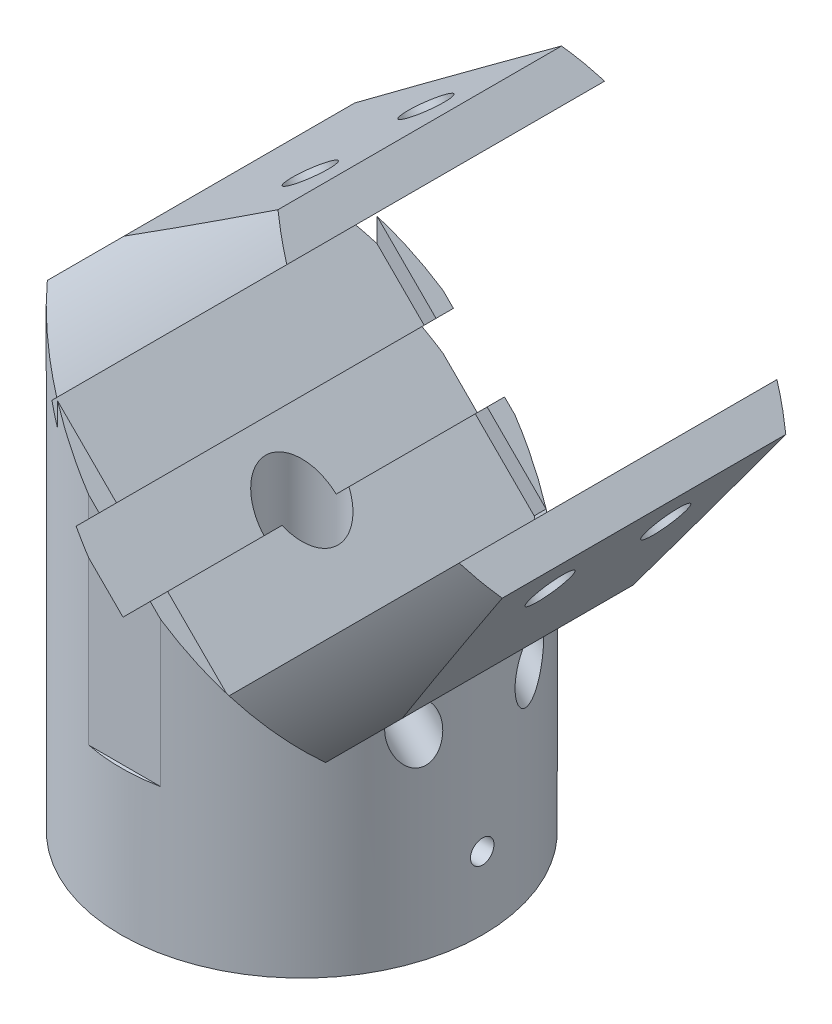
from build123d import *

# Parameters (mm, degrees)
SKETCH1_R               = 25
SKETCH1_R_2             = 20.15
BOSS_EXTRUDE1_DEPTH     = 10
SKETCH2_R               = 25
BOSS_EXTRUDE2_DEPTH     = 5
BOSS_EXTRUDE3_DEPTH     = 50
CUT_EXTRUDE1_DEPTH      = 50
SKETCH5_W               = 44
SKETCH5_H               = 33.5
CUT_EXTRUDE2_DEPTH      = 2.33
SKETCH6_W               = 31.902194282
SKETCH6_H               = 10.372222151
BOSS_EXTRUDE5_DEPTH     = 45
BOSS_EXTRUDE6_DEPTH     = 45
BOSS_EXTRUDE7_DEPTH     = 20
SKETCH10_R              = 1.375
CUT_EXTRUDE3_DEPTH      = 77
SKETCH11_R              = 1.375
CUT_EXTRUDE4_DEPTH      = 77
SKETCH12_R              = 3
CUT_EXTRUDE5_DEPTH      = 7.38
CUT_EXTRUDE6_DEPTH      = 7.88
CUT_EXTRUDE6_DEPTH_BACK = 7.38
SKETCH13_R              = 3
CHAMFER1_SIZE           = 30
CHAMFER1_SIZE_2         = 5.289809421
CUT_EXTRUDE7_DEPTH      = 37
CUT_EXTRUDE7_DEPTH_BACK = 37
SKETCH16_R              = 1.625
SKETCH17_R              = 21.025
CUT_EXTRUDE8_DEPTH      = 10
BOSS_EXTRUDE8_START     = 5
SKETCH18_R              = 25
SKETCH18_R_2            = 21.025
BOSS_EXTRUDE8_DEPTH     = 5
SKETCH19_R              = 5
CUT_EXTRUDE9_DEPTH      = 40
SKETCH20_W              = 5.989584726
SKETCH20_H              = 10
SKETCH20_W_2            = 7.89908722
CUT_EXTRUDE10_DEPTH     = 40
SKETCH20_6_W            = 5.989584726
SKETCH20_6_H            = 10
SKETCH20_6_W_2          = 7.89908722
CUT_EXTRUDE14_DEPTH     = 3
FILLET1_R               = 2


with BuildPart() as part:
    # Sketch1 → Boss-Extrude1 (new body)
    with BuildSketch(Plane(origin=(0, 0, 0), x_dir=(1, 0, 0), z_dir=(0, 1, 0))):
        with Locations(Location((0, 0, 0), (0, 0, 270))):
            Circle(SKETCH1_R)
        with Locations(Location((0, 0, 0), (0, 0, 270))):
            Circle(SKETCH1_R_2, mode=Mode.SUBTRACT)
    extrude(amount=BOSS_EXTRUDE1_DEPTH)

    # Sketch2 → Boss-Extrude2 (add)
    with BuildSketch(Plane(origin=(0, 10, 0), x_dir=(1, 0, 0), z_dir=(0, 1, 0))):
        with Locations(Location((0, 0, 0), (0, 0, 270))):
            Circle(SKETCH2_R)
    extrude(amount=BOSS_EXTRUDE2_DEPTH)

    # Sketch3 → Boss-Extrude3 (add)
    with BuildSketch(Plane(origin=(0, 15, 0), x_dir=(1, 0, 0), z_dir=(0, 1, 0))):
        with BuildLine():
            ThreePointArc((4.974937186, -24.5), (12.844564237, -21.448010853), (19.25, -15.951097141))
            Line((19.25, -15.951097141), (19.25, 15.951097141))
            ThreePointArc((19.25, 15.951097141), (12.844564237, 21.448010853), (4.974937186, 24.5))
            Line((4.974937186, 24.5), (-4.974937186, 24.5))
            ThreePointArc((-4.974937186, 24.5), (-12.844564237, 21.448010853), (-19.25, 15.951097141))
            Line((-19.25, 15.951097141), (-19.25, -15.951097141))
            ThreePointArc((-19.25, -15.951097141), (-12.844564237, -21.448010853), (-4.974937186, -24.5))
            Line((-4.974937186, -24.5), (4.974937186, -24.5))
        make_face()
    extrude(amount=BOSS_EXTRUDE3_DEPTH)

    # Sketch4 → Cut-Extrude1 (cut)
    with BuildSketch(Plane.XY.offset(24.5)):
        Polygon((-4.974937186, 44.974937186), (4.974937186, 35.025062814), (4.974937186, 65), (-4.974937186, 65), align=None)
        Polygon((4.974937186, 35.025062814), (25, 15), (25, 65), (4.974937186, 65), align=None)
        Polygon((-19.25, 59.25), (-4.974937186, 44.974937186), (-4.974937186, 65), (-19.25, 65), align=None)
    extrude(amount=-CUT_EXTRUDE1_DEPTH, mode=Mode.SUBTRACT)

    # Sketch5 → Cut-Extrude2 (cut)
    # profile 1 of 2: a face of its own
    with BuildSketch(Plane(origin=(20, 20, 0), x_dir=(0, 0, -1), z_dir=(0.7071067811865485, 0.7071067811865467, 0))):
        with BuildLine():
            Line((21.978674947, 45.132882323), (-21.978674947, 45.132882323))
            add(Edge.make_bspline(
                [(-21.978674947, 45.132882323), (-22.0399199, 44.9730967), (-22.1, 44.81242904)],
                knots=[4.215256564, 4.215256564, 4.215256564, 4.225444941, 4.225444941, 4.225444941], degree=2, weights=[0.971948047, 0.972055152, 0.97218796]))
            Line((-22.1, 44.81242904), (-22.1, 11.756113455))
            add(Edge.make_bspline(
                [(-22.1, 11.756113455), (-22.039397631, 11.594049133), (-21.977610099, 11.432882323)],
                knots=[5.19933302, 5.19933302, 5.19933302, 5.20960995, 5.20960995, 5.20960995], degree=2, weights=[0.97218796, 0.972053998, 0.971946187]))
            Line((-21.977610099, 11.432882323), (21.977610099, 11.432882323))
            add(Edge.make_bspline(
                [(21.977610099, 11.432882323), (22.039397631, 11.594049133), (22.1, 11.756113455)],
                knots=[1.073575357, 1.073575357, 1.073575357, 1.083852287, 1.083852287, 1.083852287], degree=2, weights=[0.971946187, 0.972053998, 0.97218796]))
            Line((22.1, 11.756113455), (22.1, 44.81242904))
            add(Edge.make_bspline(
                [(22.1, 44.81242904), (22.0399199, 44.9730967), (21.978674947, 45.132882323)],
                knots=[2.057740366, 2.057740366, 2.057740366, 2.067928743, 2.067928743, 2.067928743], degree=2, weights=[0.97218796, 0.972055152, 0.971948047]))
        make_face()
        with Locations((0, 28.282882323)):
            Rectangle(SKETCH5_W, SKETCH5_H, mode=Mode.SUBTRACT)
    # profile 2 of 2: a face of its own
    with BuildSketch(Plane(origin=(20, 20, 0), x_dir=(0, 0, -1), z_dir=(0.7071067811865485, 0.7071067811865467, 0))):
        with Locations((0, 28.282882323)):
            Rectangle(SKETCH5_W, SKETCH5_H)
    extrude(amount=-CUT_EXTRUDE2_DEPTH, mode=Mode.SUBTRACT)

    # Sketch6 → Boss-Extrude5 (add)
    with BuildSketch(Plane(origin=(20, 20, 0), x_dir=(0, 0, -1), z_dir=(0.7071067811865487, 0.7071067811865465, 0))):
        with BuildLine():
            Line((-15.951097141, 1.060660172), (-15.951097141, 11.432882323))
            Line((-15.951097141, 11.432882323), (-21.977610099, 11.432882323))
            add(Edge.make_bspline(
                [(-21.977610099, 11.432882323), (-19.67346685, 5.422747233), (-15.951097141, 1.060660172)],
                knots=[5.209205396, 5.209205396, 5.209205396, 5.591230132, 5.591230132, 5.591230132], degree=2, weights=[1, 0.981812537, 1]))
        make_face()
        with Locations((0, 6.246771248)):
            Rectangle(SKETCH6_W, SKETCH6_H)
        with BuildLine():
            Line((21.977610099, 11.432882323), (15.951097141, 11.432882323))
            Line((15.951097141, 11.432882323), (15.951097141, 1.060660172))
            add(Edge.make_bspline(
                [(15.951097141, 1.060660172), (19.67346685, 5.422747233), (21.977610099, 11.432882323)],
                knots=[0.691955175, 0.691955175, 0.691955175, 1.073979912, 1.073979912, 1.073979912], degree=2, weights=[1, 0.981812537, 1]))
        make_face()
    extrude(amount=BOSS_EXTRUDE5_DEPTH)

    # Sketch7 → Boss-Extrude6 (add)
    with BuildSketch(Plane(origin=(20, 20, 0), x_dir=(0, 0, -1), z_dir=(0.7071067811865487, 0.7071067811865465, 0))):
        with BuildLine():
            Line((15.951097141, 55.507882323), (-15.951097141, 55.507882323))
            add(Edge.make_bspline(
                [(-15.951097141, 55.507882323), (-19.67435923, 51.144749519), (-21.978674947, 45.132882323)],
                knots=[3.833547829, 3.833547829, 3.833547829, 4.215661937, 4.215661937, 4.215661937], degree=2, weights=[1, 0.981804052, 1]))
            Line((-21.978674947, 45.132882323), (21.978674947, 45.132882323))
            add(Edge.make_bspline(
                [(21.978674947, 45.132882323), (19.67435923, 51.144749519), (15.951097141, 55.507882323)],
                knots=[2.06752337, 2.06752337, 2.06752337, 2.449637478, 2.449637478, 2.449637478], degree=2, weights=[1, 0.981804052, 1]))
        make_face()
    extrude(amount=BOSS_EXTRUDE6_DEPTH)

    # Sketch8 → Boss-Extrude7 (add)
    with BuildSketch(Plane(origin=(0, 15, 0), x_dir=(1, 0, 0), z_dir=(0, 1, 0))):
        with BuildLine():
            ThreePointArc((25, 0), (23.518609653, 8.477912479), (19.25, 15.951097141))
            Line((19.25, 15.951097141), (19.25, -15.951097141))
            ThreePointArc((19.25, -15.951097141), (23.518609653, -8.477912479), (25, 0))
        make_face()
    extrude(amount=BOSS_EXTRUDE7_DEPTH)

    # Sketch10 → Cut-Extrude3 (cut)
    with BuildSketch(Plane(origin=(-39.25, 39.25, 0), x_dir=(0, 0, 1), z_dir=(-0.7071067811865464, 0.7071067811865487, 0))):
        with Locations(Location((8.001097141, 32.704271247, 0), (0, 0, 270))):
            Circle(SKETCH10_R)
        with Locations(Location((-7.998902859, 32.704271247, 0), (0, 0, 270))):
            Circle(SKETCH10_R)
    extrude(amount=-CUT_EXTRUDE3_DEPTH, mode=Mode.SUBTRACT)

    # Sketch11 → Cut-Extrude4 (cut)
    with BuildSketch(Plane(origin=(-39.25, 39.25, 0), x_dir=(0, 0, 1), z_dir=(-0.7071067811865464, 0.7071067811865487, 0))):
        with Locations(Location((-7.998902859, 64.704271247, 0), (0, 0, 270))):
            Circle(SKETCH11_R)
        with Locations(Location((8.001097141, 64.704271247, 0), (0, 0, 270))):
            Circle(SKETCH11_R)
    extrude(amount=-CUT_EXTRUDE4_DEPTH, mode=Mode.SUBTRACT)

    # Sketch12 → Cut-Extrude5 (cut)
    with BuildSketch(Plane(origin=(-39.25, 39.25, 0), x_dir=(0, 0, 1), z_dir=(-0.7071067811865464, 0.7071067811865487, 0))):
        with Locations(Location((-7.998902859, 64.704271247, 0), (0, 0, 270))):
            Circle(SKETCH12_R)
        with Locations(Location((8.001097141, 64.704271247, 0), (0, 0, 270))):
            Circle(SKETCH12_R)
        with Locations(Location((-7.998902859, 32.704271247, 0), (0, 0, 270))):
            Circle(SKETCH12_R)
        with Locations(Location((8.001097141, 32.704271247, 0), (0, 0, 270))):
            Circle(SKETCH12_R)
    extrude(amount=-CUT_EXTRUDE5_DEPTH, mode=Mode.SUBTRACT)

    # Sketch13 → Cut-Extrude6 (cut, two sides: drawn at the far end of the back side and taken through both)
    with BuildSketch(Plane(origin=(-0.75, 0.75, 0), x_dir=(0, 0, -1), z_dir=(0.7071067811865464, -0.7071067811865487, 0)).offset(-CUT_EXTRUDE6_DEPTH_BACK)):
        with Locations(Location((-8.001097141, 64.704271247, 0), (0, 0, 270))):
            Circle(SKETCH13_R)
        with Locations(Location((7.998902859, 64.704271247, 0), (0, 0, 270))):
            Circle(SKETCH13_R)
        with Locations(Location((-8.001097141, 32.704271247, 0), (0, 0, 270))):
            Circle(SKETCH13_R)
        with Locations(Location((7.998902859, 32.704271247, 0), (0, 0, 270))):
            Circle(SKETCH13_R)
    extrude(amount=CUT_EXTRUDE6_DEPTH + CUT_EXTRUDE6_DEPTH_BACK, mode=Mode.SUBTRACT)

    # Chamfer1
    # the kernel refuses this chamfer: 30, 5.289809421 mm, written as the material it takes off along each edge
    with BuildSketch(Plane(origin=(51.069805153, 52.569805153, 93.907261034), x_dir=(-0.7023657291994666, -0.7118162560985113, 0), z_dir=(0, 0, -1)), Plane(origin=(12.569805153, 91.069805153, -93.907261034), x_dir=(-0.7118162560985133, -0.7023657291994647, 0), z_dir=(0, 0, 1))) as chamfer1_piece_1:
        Polygon((CHAMFER1_SIZE * 0.999977671636, CHAMFER1_SIZE * 0.0066825316561), (-CHAMFER1_SIZE_2 * 0.00668253165642, CHAMFER1_SIZE_2 * 0.999977671684), (0, 0), align=None)
    extrude(amount=187.814522067, mode=Mode.SUBTRACT)

    # Sketch16 → Cut-Extrude7 (cut, two sides: drawn at the far end of the back side and taken through both)
    with BuildSketch(Plane(origin=(0, 0, 0), x_dir=(0, 0, -1), z_dir=(1, 0, 0)).offset(-CUT_EXTRUDE7_DEPTH_BACK)):
        with Locations(Location((0, 5, 0), (0, 0, 180))):
            Circle(SKETCH16_R)
    extrude(amount=CUT_EXTRUDE7_DEPTH + CUT_EXTRUDE7_DEPTH_BACK, mode=Mode.SUBTRACT)

    # Sketch17 → Cut-Extrude8 (cut)
    with BuildSketch(Plane.XZ):
        with Locations(Location((0, 0, 0), (0, 0, 270))):
            Circle(SKETCH17_R)
    extrude(amount=-CUT_EXTRUDE8_DEPTH, mode=Mode.SUBTRACT)

    # Sketch18 → Boss-Extrude8 (add)
    with BuildSketch(Plane.XZ.offset(BOSS_EXTRUDE8_START)):
        with Locations(Location((0, 0, 0), (0, 0, 270))):
            Circle(SKETCH18_R)
        with Locations(Location((0, 0, 0), (0, 0, 270))):
            Circle(SKETCH18_R_2, mode=Mode.SUBTRACT)
    extrude(amount=-BOSS_EXTRUDE8_DEPTH)

    # Sketch19 → Cut-Extrude9 (cut)
    with BuildSketch(Plane.XZ.offset(-10)):
        with Locations(Location((0, 0, 0), (0, 0, 270))):
            Circle(SKETCH19_R)
    extrude(amount=-CUT_EXTRUDE9_DEPTH, mode=Mode.SUBTRACT)

    # Sketch20 → Cut-Extrude10 (cut)
    with BuildSketch(Plane(origin=(18.3524412, 18.3524412, 0), x_dir=(0, 0, -1), z_dir=(0.7071067811865482, 0.7071067811865468, 0))):
        with Locations((-25.094792363, 28.282882323)):
            Rectangle(SKETCH20_W, SKETCH20_H)
        with Locations((26.04954361, 28.282882323)):
            Rectangle(SKETCH20_W_2, SKETCH20_H)
    extrude(amount=CUT_EXTRUDE10_DEPTH, mode=Mode.SUBTRACT)

    # Sketch20<6> → Cut-Extrude14 (cut)
    with BuildSketch(Plane(origin=(18.3524412, 18.3524412, 0), x_dir=(0, 0, -1), z_dir=(0.7071067811865482, 0.7071067811865468, 0))):
        with BuildLine():
            Line((22.1, 33.282882323), (-22.1, 33.282882323))
            Line((-22.1, 33.282882323), (-22.1, 23.282882323))
            Line((-22.1, 23.282882323), (-4.629453597, 23.282882323))
            add(Edge.make_bspline(
                [(4.629453597, 23.282882323), (7.440356706, 33.025339059), (0, 33.025339059), (-7.440356706, 33.025339059), (-4.629453597, 23.282882323)],
                knots=[1.183386525, 1.183386525, 1.183386525, 3.141592654, 3.141592654, 5.099798782, 5.099798782, 5.099798782], degree=2, weights=[1, 0.557767225, 1, 0.557767225, 1]))
            Line((4.629453597, 23.282882323), (22.1, 23.282882323))
            Line((22.1, 23.282882323), (22.1, 33.282882323))
        make_face()
        with BuildLine():
            add(Edge.make_bspline(
                [(4.629453597, 23.282882323), (7.440356706, 33.025339059), (0, 33.025339059), (-7.440356706, 33.025339059), (-4.629453597, 23.282882323)],
                knots=[1.183386525, 1.183386525, 1.183386525, 3.141592654, 3.141592654, 5.099798782, 5.099798782, 5.099798782], degree=2, weights=[1, 0.557767225, 1, 0.557767225, 1]))
            Line((-4.629453597, 23.282882323), (4.629453597, 23.282882323))
        make_face()
        with BuildLine():
            Line((4.629453597, 23.282882323), (-4.629453597, 23.282882323))
            add(Edge.make_bspline(
                [(-4.629453597, 23.282882323), (-3.360053958, 18.883203436), (0, 18.883203436)],
                knots=[5.099798782, 5.099798782, 5.099798782, 6.283185307, 6.283185307, 6.283185307], degree=2, weights=[1, 0.829997423, 1]))
            add(Edge.make_bspline(
                [(0, 18.883203436), (3.360053958, 18.883203436), (4.629453597, 23.282882323)],
                knots=[0, 0, 0, 1.183386525, 1.183386525, 1.183386525], degree=2, weights=[1, 0.829997423, 1]))
        make_face()
        with Locations((-25.094792363, 28.282882323)):
            Rectangle(SKETCH20_6_W, SKETCH20_6_H)
        with Locations((26.04954361, 28.282882323)):
            Rectangle(SKETCH20_6_W_2, SKETCH20_6_H)
    extrude(amount=-CUT_EXTRUDE14_DEPTH, mode=Mode.SUBTRACT)

    # Fillet1
    fillet1_edges = [part.edges().sort_by_distance(p)[0] for p in [
        (0, -5, 21.025),
    ]]
    fillet(fillet1_edges, radius=FILLET1_R)


solid = part.part
